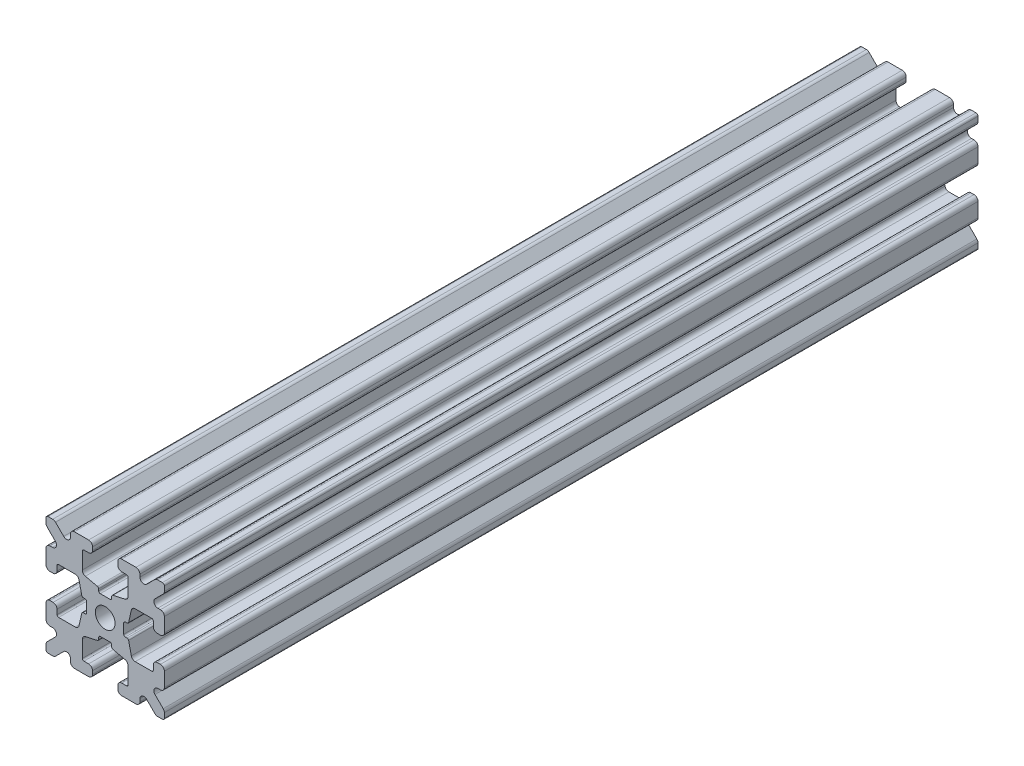
from build123d import *

# Parameters (mm, degrees)
SKETCH1_R           = 1.25
BOSS_EXTRUDE1_DEPTH = 103.1113


with BuildPart() as part:
    # Sketch1 → Boss-Extrude1 (new body)
    with BuildSketch(Plane.XY.offset(150)):
        with BuildLine():
            Line((0.981757709, -2.970049142), (2.509355729, -3.312441801))
            ThreePointArc((2.509355729, -3.312441801), (2.790306204, -3.487828881), (2.900000001, -3.80033659))
            Line((2.900000001, -3.80033659), (2.900000001, -5.9))
            ThreePointArc((2.900000001, -5.9), (2.841421357, -6.041421356), (2.700000001, -6.1))
            Line((2.700000001, -6.1), (2.1, -6.1))
            ThreePointArc((2.1, -6.1), (1.746446609, -6.246446609), (1.6, -6.6))
            Line((1.6, -6.6), (1.6, -7))
            ThreePointArc((1.6, -7), (1.746446609, -7.353553391), (2.1, -7.5))
            Line((2.1, -7.5), (3.9, -7.5))
            ThreePointArc((3.9, -7.5), (4.253553391, -7.353553391), (4.4, -7))
            Line((4.4, -7), (4.4, -6.667766953))
            ThreePointArc((4.4, -6.667766953), (4.708658284, -6.205827187), (5.253553391, -6.314213563))
            Line((5.253553391, -6.314213563), (6.292893218, -7.353553391))
            ThreePointArc((6.292893218, -7.353553391), (6.455104893, -7.461939766), (6.646446609, -7.5))
            Line((6.646446609, -7.5), (7.25, -7.5))
            ThreePointArc((7.25, -7.5), (7.426776695, -7.426776695), (7.5, -7.25))
            Line((7.5, -7.25), (7.5, -6.646446609))
            ThreePointArc((7.5, -6.646446609), (7.461939766, -6.455104893), (7.353553391, -6.292893218))
            Line((7.353553391, -6.292893218), (6.314213563, -5.253553391))
            ThreePointArc((6.314213563, -5.253553391), (6.205827187, -4.708658284), (6.667766953, -4.4))
            Line((6.667766953, -4.4), (7, -4.4))
            ThreePointArc((7, -4.4), (7.353553391, -4.253553391), (7.5, -3.9))
            Line((7.5, -3.9), (7.5, -2.1))
            ThreePointArc((7.5, -2.1), (7.353553391, -1.746446609), (7, -1.6))
            Line((7, -1.6), (6.6, -1.6))
            ThreePointArc((6.6, -1.6), (6.246446609, -1.746446609), (6.1, -2.1))
            Line((6.1, -2.1), (6.1, -2.7))
            ThreePointArc((6.1, -2.7), (6.041421356, -2.841421356), (5.9, -2.9))
            Line((5.9, -2.9), (3.800336589, -2.9))
            ThreePointArc((3.800336589, -2.9), (3.487828881, -2.790306203), (3.312441801, -2.509355728))
            Line((3.312441801, -2.509355728), (2.970049141, -0.981757708))
            ThreePointArc((2.970049141, -0.981757708), (2.899894309, -0.869377518), (2.774891226, -0.8255))
            Line((2.774891226, -0.8255), (2.5470646, -0.8255))
            ThreePointArc((2.5470646, -0.8255), (2.405643243, -0.766921356), (2.3470646, -0.6255))
            Line((2.3470646, -0.6255), (2.3470646, 0.6255))
            ThreePointArc((2.3470646, 0.6255), (2.405643243, 0.766921356), (2.5470646, 0.8255))
            Line((2.5470646, 0.8255), (2.774891226, 0.8255))
            ThreePointArc((2.774891226, 0.8255), (2.899894309, 0.869377518), (2.970049141, 0.981757708))
            Line((2.970049141, 0.981757708), (3.312441801, 2.509355728))
            ThreePointArc((3.312441801, 2.509355728), (3.487828881, 2.790306203), (3.800336589, 2.9))
            Line((3.800336589, 2.9), (5.9, 2.9))
            ThreePointArc((5.9, 2.9), (6.041421356, 2.841421356), (6.1, 2.7))
            Line((6.1, 2.7), (6.1, 2.1))
            ThreePointArc((6.1, 2.1), (6.246446609, 1.746446609), (6.6, 1.6))
            Line((6.6, 1.6), (7, 1.6))
            ThreePointArc((7, 1.6), (7.353553391, 1.746446609), (7.5, 2.1))
            Line((7.5, 2.1), (7.5, 3.9))
            ThreePointArc((7.5, 3.9), (7.353553391, 4.253553391), (7, 4.4))
            Line((7, 4.4), (6.667766953, 4.4))
            ThreePointArc((6.667766953, 4.4), (6.205827187, 4.708658284), (6.314213563, 5.253553391))
            Line((6.314213563, 5.253553391), (7.353553391, 6.292893218))
            ThreePointArc((7.353553391, 6.292893218), (7.461939766, 6.455104893), (7.5, 6.646446609))
            Line((7.5, 6.646446609), (7.5, 7.25))
            ThreePointArc((7.5, 7.25), (7.426776695, 7.426776695), (7.25, 7.5))
            Line((7.25, 7.5), (6.646446609, 7.5))
            ThreePointArc((6.646446609, 7.5), (6.455104893, 7.461939766), (6.292893218, 7.353553391))
            Line((6.292893218, 7.353553391), (5.253553391, 6.314213563))
            ThreePointArc((5.253553391, 6.314213563), (4.708658284, 6.205827187), (4.4, 6.667766954))
            Line((4.4, 6.667766954), (4.4, 7))
            ThreePointArc((4.4, 7), (4.253553391, 7.353553391), (3.9, 7.5))
            Line((3.9, 7.5), (2.1, 7.5))
            ThreePointArc((2.1, 7.5), (1.746446609, 7.353553391), (1.6, 7))
            Line((1.6, 7), (1.6, 6.6))
            ThreePointArc((1.6, 6.6), (1.746446609, 6.246446609), (2.1, 6.1))
            Line((2.1, 6.1), (2.700000001, 6.1))
            ThreePointArc((2.700000001, 6.1), (2.841421357, 6.041421356), (2.900000001, 5.9))
            Line((2.900000001, 5.9), (2.900000001, 3.800336589))
            ThreePointArc((2.900000001, 3.800336589), (2.790306204, 3.487828881), (2.509355729, 3.312441801))
            Line((2.509355729, 3.312441801), (0.981757709, 2.970049141))
            ThreePointArc((0.981757709, 2.970049141), (0.869377519, 2.899894309), (0.8255, 2.774891226))
            Line((0.8255, 2.774891226), (0.8255, 2.5470646))
            ThreePointArc((0.8255, 2.5470646), (0.766921357, 2.405643243), (0.6255, 2.3470646))
            Line((0.6255, 2.3470646), (-0.6255, 2.3470646))
            ThreePointArc((-0.6255, 2.3470646), (-0.766921356, 2.405643243), (-0.8255, 2.5470646))
            Line((-0.8255, 2.5470646), (-0.8255, 2.774891226))
            ThreePointArc((-0.8255, 2.774891226), (-0.869377518, 2.89989431), (-0.981757708, 2.970049142))
            Line((-0.981757708, 2.970049142), (-2.509355728, 3.312441801))
            ThreePointArc((-2.509355728, 3.312441801), (-2.790306203, 3.487828881), (-2.9, 3.80033659))
            Line((-2.9, 3.80033659), (-2.9, 5.9))
            ThreePointArc((-2.9, 5.9), (-2.841421356, 6.041421356), (-2.7, 6.1))
            Line((-2.7, 6.1), (-2.1, 6.1))
            ThreePointArc((-2.1, 6.1), (-1.746446609, 6.246446609), (-1.6, 6.6))
            Line((-1.6, 6.6), (-1.6, 7))
            ThreePointArc((-1.6, 7), (-1.746446609, 7.353553391), (-2.1, 7.5))
            Line((-2.1, 7.5), (-3.9, 7.5))
            ThreePointArc((-3.9, 7.5), (-4.25355339, 7.353553391), (-4.4, 7))
            Line((-4.4, 7), (-4.4, 6.667766953))
            ThreePointArc((-4.4, 6.667766953), (-4.708658283, 6.205827187), (-5.25355339, 6.314213563))
            Line((-5.25355339, 6.314213563), (-6.292893218, 7.353553391))
            ThreePointArc((-6.292893218, 7.353553391), (-6.455104893, 7.461939766), (-6.646446609, 7.5))
            Line((-6.646446609, 7.5), (-7.25, 7.5))
            ThreePointArc((-7.25, 7.5), (-7.426776695, 7.426776695), (-7.5, 7.25))
            Line((-7.5, 7.25), (-7.5, 6.646446609))
            ThreePointArc((-7.5, 6.646446609), (-7.461939766, 6.455104893), (-7.353553391, 6.292893218))
            Line((-7.353553391, 6.292893218), (-6.314213563, 5.253553391))
            ThreePointArc((-6.314213563, 5.253553391), (-6.205827187, 4.708658284), (-6.667766953, 4.4))
            Line((-6.667766953, 4.4), (-7, 4.4))
            ThreePointArc((-7, 4.4), (-7.353553391, 4.253553391), (-7.5, 3.9))
            Line((-7.5, 3.9), (-7.5, 2.1))
            ThreePointArc((-7.5, 2.1), (-7.353553391, 1.746446609), (-7, 1.6))
            Line((-7, 1.6), (-6.6, 1.6))
            ThreePointArc((-6.6, 1.6), (-6.246446609, 1.746446609), (-6.1, 2.1))
            Line((-6.1, 2.1), (-6.1, 2.7))
            ThreePointArc((-6.1, 2.7), (-6.041421356, 2.841421356), (-5.9, 2.9))
            Line((-5.9, 2.9), (-3.80033659, 2.9))
            ThreePointArc((-3.80033659, 2.9), (-3.487828881, 2.790306203), (-3.312441801, 2.509355728))
            Line((-3.312441801, 2.509355728), (-2.970049142, 0.981757708))
            ThreePointArc((-2.970049142, 0.981757708), (-2.89989431, 0.869377518), (-2.774891226, 0.8255))
            Line((-2.774891226, 0.8255), (-2.5470646, 0.8255))
            ThreePointArc((-2.5470646, 0.8255), (-2.405643244, 0.766921356), (-2.3470646, 0.6255))
            Line((-2.3470646, 0.6255), (-2.3470646, -0.6255))
            ThreePointArc((-2.3470646, -0.6255), (-2.405643244, -0.766921356), (-2.5470646, -0.8255))
            Line((-2.5470646, -0.8255), (-2.774891226, -0.8255))
            ThreePointArc((-2.774891226, -0.8255), (-2.89989431, -0.869377518), (-2.970049142, -0.981757708))
            Line((-2.970049142, -0.981757708), (-3.312441801, -2.509355728))
            ThreePointArc((-3.312441801, -2.509355728), (-3.487828881, -2.790306203), (-3.80033659, -2.9))
            Line((-3.80033659, -2.9), (-5.9, -2.9))
            ThreePointArc((-5.9, -2.9), (-6.041421356, -2.841421356), (-6.1, -2.7))
            Line((-6.1, -2.7), (-6.1, -2.1))
            ThreePointArc((-6.1, -2.1), (-6.246446609, -1.746446609), (-6.6, -1.6))
            Line((-6.6, -1.6), (-7, -1.6))
            ThreePointArc((-7, -1.6), (-7.353553391, -1.746446609), (-7.5, -2.1))
            Line((-7.5, -2.1), (-7.5, -3.9))
            ThreePointArc((-7.5, -3.9), (-7.353553391, -4.253553391), (-7, -4.4))
            Line((-7, -4.4), (-6.667766953, -4.4))
            ThreePointArc((-6.667766953, -4.4), (-6.205827187, -4.708658284), (-6.314213563, -5.253553391))
            Line((-6.314213563, -5.253553391), (-7.353553391, -6.292893218))
            ThreePointArc((-7.353553391, -6.292893218), (-7.461939766, -6.455104893), (-7.5, -6.646446609))
            Line((-7.5, -6.646446609), (-7.5, -7.25))
            ThreePointArc((-7.5, -7.25), (-7.426776695, -7.426776695), (-7.25, -7.5))
            Line((-7.25, -7.5), (-6.646446609, -7.5))
            ThreePointArc((-6.646446609, -7.5), (-6.455104893, -7.461939766), (-6.292893218, -7.353553391))
            Line((-6.292893218, -7.353553391), (-5.25355339, -6.314213563))
            ThreePointArc((-5.25355339, -6.314213563), (-4.708658284, -6.205827187), (-4.4, -6.667766953))
            Line((-4.4, -6.667766953), (-4.4, -7))
            ThreePointArc((-4.4, -7), (-4.25355339, -7.353553391), (-3.9, -7.5))
            Line((-3.9, -7.5), (-2.1, -7.5))
            ThreePointArc((-2.1, -7.5), (-1.746446609, -7.353553391), (-1.6, -7))
            Line((-1.6, -7), (-1.6, -6.6))
            ThreePointArc((-1.6, -6.6), (-1.746446609, -6.246446609), (-2.1, -6.1))
            Line((-2.1, -6.1), (-2.7, -6.1))
            ThreePointArc((-2.7, -6.1), (-2.841421356, -6.041421356), (-2.9, -5.9))
            Line((-2.9, -5.9), (-2.9, -3.80033659))
            ThreePointArc((-2.9, -3.80033659), (-2.790306203, -3.487828881), (-2.509355728, -3.312441801))
            Line((-2.509355728, -3.312441801), (-0.981757708, -2.970049142))
            ThreePointArc((-0.981757708, -2.970049142), (-0.869377518, -2.89989431), (-0.8255, -2.774891226))
            Line((-0.8255, -2.774891226), (-0.8255, -2.5470646))
            ThreePointArc((-0.8255, -2.5470646), (-0.766921356, -2.405643244), (-0.6255, -2.3470646))
            Line((-0.6255, -2.3470646), (0.6255, -2.3470646))
            ThreePointArc((0.6255, -2.3470646), (0.766921357, -2.405643244), (0.8255, -2.5470646))
            Line((0.8255, -2.5470646), (0.8255, -2.774891226))
            ThreePointArc((0.8255, -2.774891226), (0.869377519, -2.89989431), (0.981757709, -2.970049142))
        make_face()
        Circle(SKETCH1_R, mode=Mode.SUBTRACT)
    extrude(amount=-BOSS_EXTRUDE1_DEPTH)


solid = part.part
